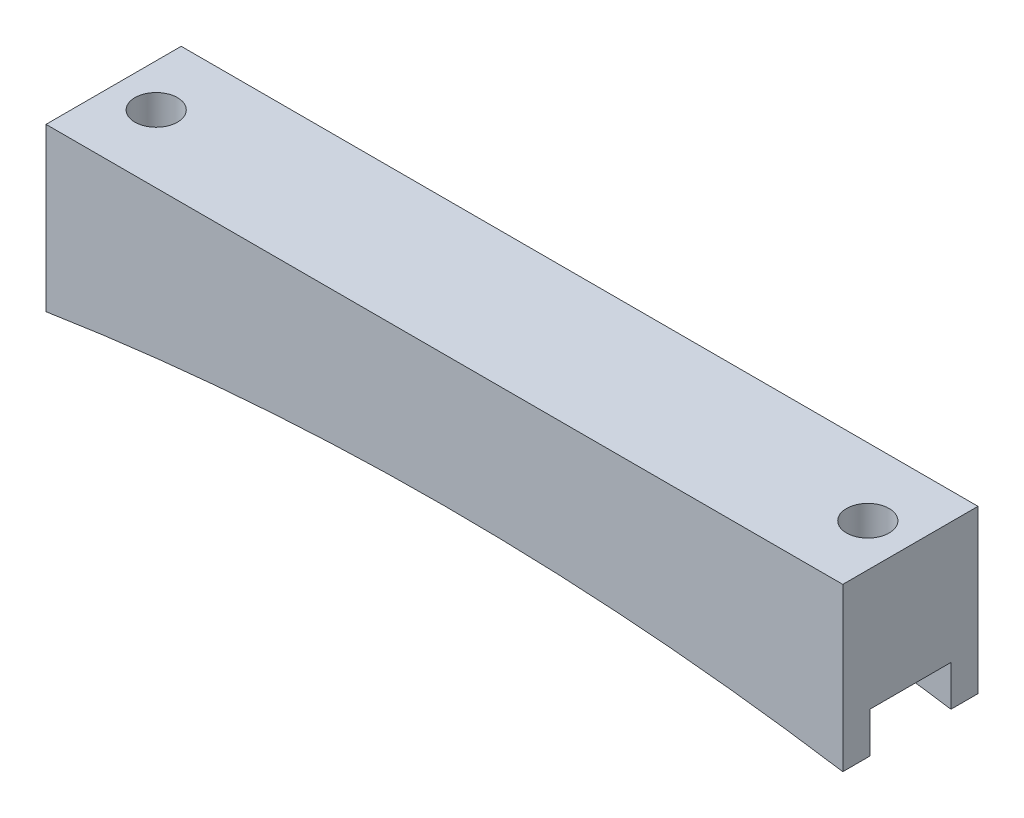
from build123d import *

# Parameters (mm, degrees)
BOSS_EXTRUDE1_DEPTH = 12.7
SKETCH2_R           = 2
CUT_EXTRUDE1_DEPTH  = 6.5
SKETCH3_W           = 7.62
SKETCH3_H           = 3.81
CUT_EXTRUDE2_DEPTH  = 78.425511485


with BuildPart() as part:
    # Sketch1 → Boss-Extrude1 (new body)
    with BuildSketch(Plane.XY):
        with BuildLine():
            Line((-37.4204564, 0), (37.4204564, 0))
            Line((37.4204564, 0), (37.4204564, -15.24))
            ThreePointArc((37.4204564, -15.24), (0, -12.320786648), (-37.4204564, -15.24))
            Line((-37.4204564, -15.24), (-37.4204564, 0))
        make_face()
    extrude(amount=BOSS_EXTRUDE1_DEPTH)

    # Sketch2 → Cut-Extrude1 (cut)
    with BuildSketch(Plane(origin=(0, 0, 0), x_dir=(1, 0, 0), z_dir=(0, 1, 0))):
        with Locations((-33.4204564, -6.35)):
            Circle(SKETCH2_R)
        with Locations((33.4204564, -6.35)):
            Circle(SKETCH2_R)
    extrude(amount=-CUT_EXTRUDE1_DEPTH, mode=Mode.SUBTRACT)

    # Sketch3 → Cut-Extrude2 (cut, through all)
    with BuildSketch(Plane(origin=(37.4204564, 0, 0), x_dir=(0, 0, -1), z_dir=(1, 0, 0))):
        with Locations((-6.35, -13.335)):
            Rectangle(SKETCH3_W, SKETCH3_H)
    extrude(amount=-CUT_EXTRUDE2_DEPTH, mode=Mode.SUBTRACT)


solid = part.part
